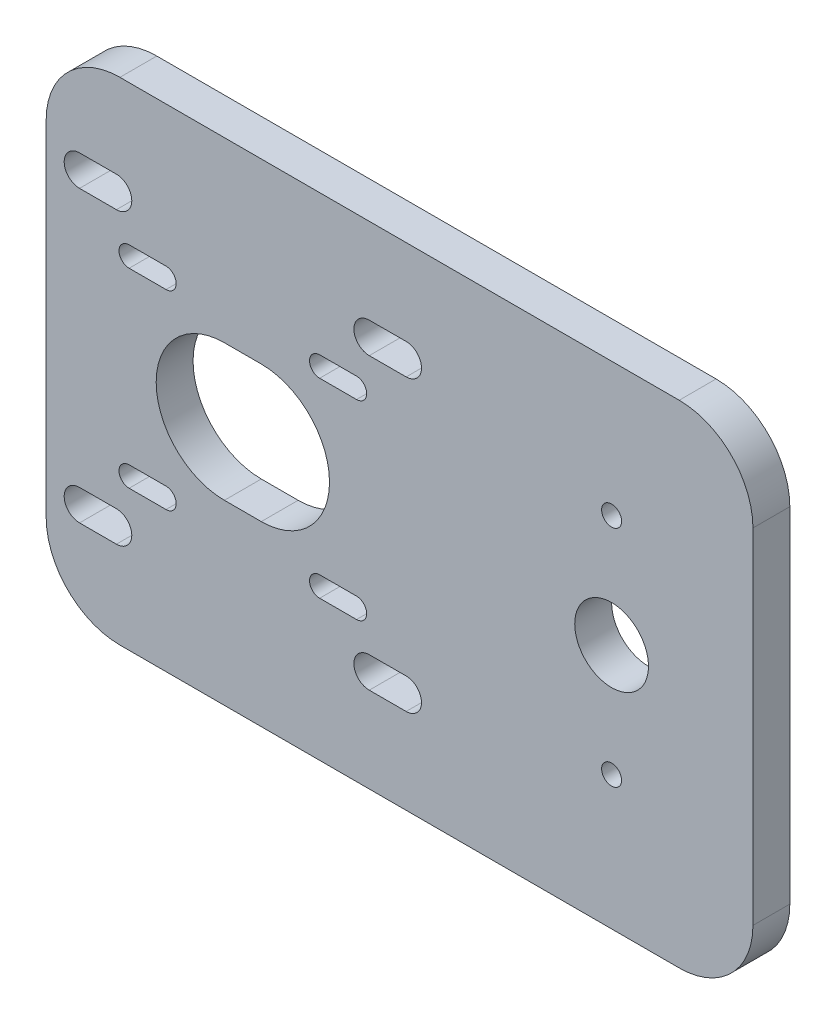
from build123d import *

# Parameters (mm, degrees)
CROQUIS1_W              = 115
CROQUIS1_H              = 80
SALIENTE_EXTRUIR1_DEPTH = 6
CROQUIS2_R              = 6
CROQUIS2_R_2            = 1.625
CORTAR_EXTRUIR1_DEPTH   = 141.2176879
REDONDEO1_R             = 12


with BuildPart() as part:
    # Croquis1 → Saliente-Extruir1 (new body)
    with BuildSketch(Plane.XY):
        with Locations((57.5, 40)):
            Rectangle(CROQUIS1_W, CROQUIS1_H)
    extrude(amount=SALIENTE_EXTRUIR1_DEPTH)

    # Croquis2 → Cortar-Extruir1 (cut, through all)
    with BuildSketch(Plane(origin=(0, 0, 0), x_dir=(-1, 0, 0), z_dir=(0, 0, -1))):
        with Locations((-92, 40)):
            Circle(CROQUIS2_R)
        with Locations((-92, 21.75)):
            Circle(CROQUIS2_R_2)
        with Locations((-92, 58.25)):
            Circle(CROQUIS2_R_2)
        with BuildLine():
            Line((-29, 28.9), (-35, 28.9))
            ThreePointArc((-35, 28.9), (-46.1, 40), (-35, 51.1))
            Line((-35, 51.1), (-29, 51.1))
            ThreePointArc((-29, 51.1), (-17.9, 40), (-29, 28.9))
        make_face()
        with BuildLine():
            Line((-13.5, 22.85), (-19.5, 22.85))
            ThreePointArc((-19.5, 22.85), (-21.15, 24.5), (-19.5, 26.15))
            Line((-19.5, 26.15), (-13.5, 26.15))
            ThreePointArc((-13.5, 26.15), (-11.85, 24.5), (-13.5, 22.85))
        make_face()
        with BuildLine():
            Line((-44.5, 53.85), (-50.5, 53.85))
            ThreePointArc((-50.5, 53.85), (-52.15, 55.5), (-50.5, 57.15))
            Line((-50.5, 57.15), (-44.5, 57.15))
            ThreePointArc((-44.5, 57.15), (-42.85, 55.5), (-44.5, 53.85))
        make_face()
        with BuildLine():
            Line((-44.5, 22.85), (-50.5, 22.85))
            ThreePointArc((-50.5, 22.85), (-52.15, 24.5), (-50.5, 26.15))
            Line((-50.5, 26.15), (-44.5, 26.15))
            ThreePointArc((-44.5, 26.15), (-42.85, 24.5), (-44.5, 22.85))
        make_face()
        with BuildLine():
            Line((-13.5, 53.85), (-19.5, 53.85))
            ThreePointArc((-19.5, 53.85), (-21.15, 55.5), (-19.5, 57.15))
            Line((-19.5, 57.15), (-13.5, 57.15))
            ThreePointArc((-13.5, 57.15), (-11.85, 55.5), (-13.5, 53.85))
        make_face()
        with BuildLine():
            Line((-52.57, 13.93), (-58.57, 13.93))
            ThreePointArc((-58.57, 13.93), (-61.07, 16.43), (-58.57, 18.93))
            Line((-58.57, 18.93), (-52.57, 18.93))
            ThreePointArc((-52.57, 18.93), (-50.07, 16.43), (-52.57, 13.93))
        make_face()
        with BuildLine():
            Line((-5.43, 13.93), (-11.43, 13.93))
            ThreePointArc((-11.43, 13.93), (-13.93, 16.43), (-11.43, 18.93))
            Line((-11.43, 18.93), (-5.43, 18.93))
            ThreePointArc((-5.43, 18.93), (-2.93, 16.43), (-5.43, 13.93))
        make_face()
        with BuildLine():
            Line((-52.57, 61.07), (-58.57, 61.07))
            ThreePointArc((-58.57, 61.07), (-61.07, 63.57), (-58.57, 66.07))
            Line((-58.57, 66.07), (-52.57, 66.07))
            ThreePointArc((-52.57, 66.07), (-50.07, 63.57), (-52.57, 61.07))
        make_face()
        with BuildLine():
            Line((-5.43, 61.07), (-11.43, 61.07))
            ThreePointArc((-11.43, 61.07), (-13.93, 63.57), (-11.43, 66.07))
            Line((-11.43, 66.07), (-5.43, 66.07))
            ThreePointArc((-5.43, 66.07), (-2.93, 63.57), (-5.43, 61.07))
        make_face()
    extrude(amount=-CORTAR_EXTRUIR1_DEPTH, mode=Mode.SUBTRACT)

    # Redondeo1
    redondeo1_edges = [part.edges().sort_by_distance(p)[0] for p in [
        (115, 0, 3),
        (115, 80, 3),
        (0, 0, 3),
        (0, 80, 3),
    ]]
    fillet(redondeo1_edges, radius=REDONDEO1_R)


solid = part.part
